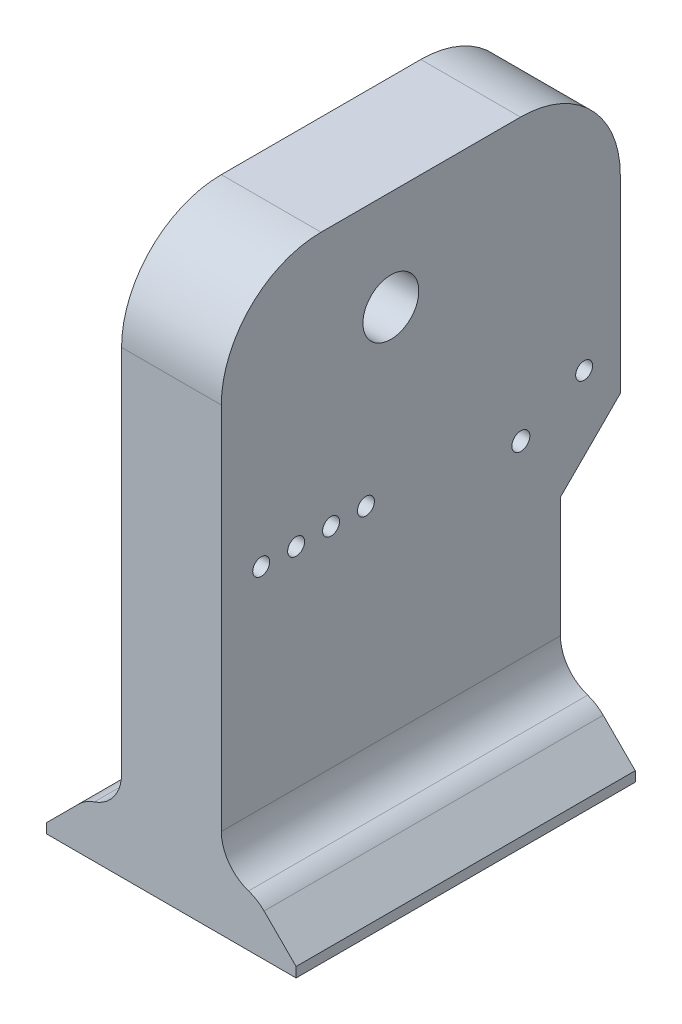
from build123d import *

# Parameters (mm, degrees)
SKETCH1_W           = 25
SKETCH1_H           = 34
BOSS_EXTRUDE1_DEPTH = 5
SKETCH2_W           = 10
SKETCH2_H           = 34
BOSS_EXTRUDE2_DEPTH = 51
SKETCH3_R           = 2.8
CUT_EXTRUDE1_DEPTH  = 41
CHAMFER1_SIZE       = 4
FILLET1_R           = 4
FILLET2_R           = 4
SKETCH4_R           = 0.85
CUT_EXTRUDE2_DEPTH  = 41
SKETCH5_W           = 10
SKETCH5_H           = 20
BOSS_EXTRUDE3_DEPTH = 6
CHAMFER3_SIZE       = 15
FILLET4_R           = 10
SKETCH7_R           = 0.9
SKETCH7_R_2         = 0.85
CUT_EXTRUDE3_DEPTH  = 13


with BuildPart() as part:
    # Sketch1 → Boss-Extrude1 (new body)
    with BuildSketch(Plane(origin=(0, 0, 0), x_dir=(1, 0, 0), z_dir=(0, 1, 0))):
        Rectangle(SKETCH1_W, SKETCH1_H)
    extrude(amount=BOSS_EXTRUDE1_DEPTH)

    # Sketch2 → Boss-Extrude2 (add)
    with BuildSketch(Plane(origin=(0, 5, 0), x_dir=(1, 0, 0), z_dir=(0, 1, 0))):
        Rectangle(SKETCH2_W, SKETCH2_H)
    extrude(amount=BOSS_EXTRUDE2_DEPTH)

    # Sketch3 → Cut-Extrude1 (cut)
    with BuildSketch(Plane.ZY.offset(5)):
        with Locations((0, 46)):
            Circle(SKETCH3_R)
    extrude(amount=-CUT_EXTRUDE1_DEPTH, mode=Mode.SUBTRACT)

    # Chamfer1
    chamfer1_edges = [part.edges().sort_by_distance(p)[0] for p in [
        (-12.5, 5, 0),
        (12.5, 5, 0),
    ]]
    chamfer(chamfer1_edges, length=CHAMFER1_SIZE)

    # Fillet1
    # the kernel refuses this fillet: 4 mm, written as the material it adds along each edge
    with BuildSketch(Plane(origin=(5, 5, 17), x_dir=(1, 0, 0), z_dir=(0, 0, -1)), Plane(origin=(-5, 5, -17), x_dir=(-1, 0, 0), z_dir=(0, 0, 1))) as fillet1_piece_1:
        with BuildLine():
            CenterArc((4, -3.968626967), FILLET1_R, 97.180755781, 82.819244219)
            Line((0, -3.968626967), (-0.08, -3.968626967))
            Line((-0.08, -3.968626967), (-0.08, 0))
            Line((-0.08, 0), (0, 0.08))
            ThreePointArc((0, 0.08), (1.75, 0.08), (3.49, 0.079372539))
            Line((3.49, 0.079372539), (3.5, 0))
        make_face()
    extrude(amount=34)

    # Fillet2
    fillet2_edges = [part.edges().sort_by_distance(p)[0] for p in [
        (8.5, 5, 0),
        (-8.5, 5, 0),
    ]]
    fillet(fillet2_edges, radius=FILLET2_R)

    # Sketch4 → Cut-Extrude2 (cut)
    with BuildSketch(Plane.ZY.offset(5)):
        with Locations((6, 29.968626967)):
            Circle(SKETCH4_R)
        with Locations((13, 29.968626967)):
            Circle(SKETCH4_R)
        with Locations((2.5, 29.968626967)):
            Circle(SKETCH4_R)
        with Locations((9.5, 29.968626967)):
            Circle(SKETCH4_R)
    extrude(amount=-CUT_EXTRUDE2_DEPTH, mode=Mode.SUBTRACT)

    # Sketch5 → Boss-Extrude3 (add)
    with BuildSketch(Plane(origin=(0, 0, -17), x_dir=(-1, 0, 0), z_dir=(0, 0, -1))):
        with Locations((0, 46)):
            Rectangle(SKETCH5_W, SKETCH5_H)
    extrude(amount=BOSS_EXTRUDE3_DEPTH)

    # Chamfer3
    # the kernel refuses this chamfer: 15 mm, written as the material it adds along each edge
    with BuildSketch(Plane(origin=(-5, 36, -17), x_dir=(0, -0.9996219169112968, 0.02749587661058632), z_dir=(1, 0, 0))) as chamfer3_piece_1_section:
        Polygon((CHAMFER3_SIZE * 0.999621916911, CHAMFER3_SIZE * 0.0274958766106), (-CHAMFER3_SIZE * 0.0274958766106, CHAMFER3_SIZE * 0.999621916911), (0, 0), align=None)
    chamfer3_piece_1 = extrude(amount=10, mode=Mode.PRIVATE)
    chamfer3_piece_1 = split(chamfer3_piece_1, bisect_by=Plane(origin=(0, 29.791642651, -23), z_dir=(0, 0, 1)), keep=Keep.TOP, mode=Mode.PRIVATE)
    add(chamfer3_piece_1)

    # Fillet4
    fillet4_edges = [part.edges().sort_by_distance(p)[0] for p in [
        (0, 56, 17),
        (0, 56, -23),
    ]]
    fillet(fillet4_edges, radius=FILLET4_R)

    # Sketch7 → Cut-Extrude3 (cut)
    with BuildSketch(Plane(origin=(5, 0, 0), x_dir=(0, 0, -1), z_dir=(1, 0, 0))):
        with Locations((13.030614343, 27.851199121)):
            Circle(SKETCH7_R)
        with Locations((19.374768852, 30.809526953)):
            Circle(SKETCH7_R_2)
    extrude(amount=-CUT_EXTRUDE3_DEPTH, mode=Mode.SUBTRACT)


solid = part.part
